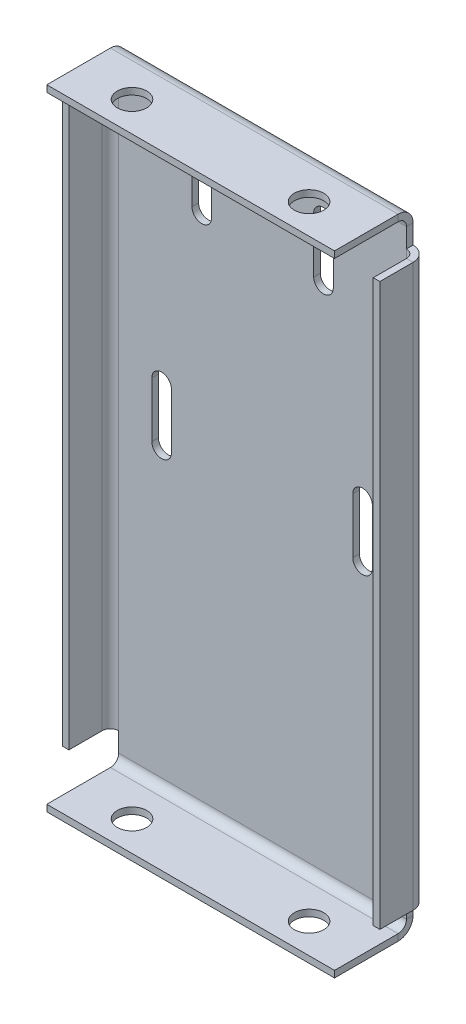
from build123d import *

# Parameters (mm, degrees)
SKETCH1_W           = 66.04
SKETCH1_H           = 147.574
BOSS_EXTRUDE1_DEPTH = 3.03784
SKETCH3_W           = 66.04
SKETCH3_H           = 3.03784
BOSS_EXTRUDE2_DEPTH = 16.51
SKETCH4_R           = 3.3782
CUT_EXTRUDE1_DEPTH  = 163.854183627
SKETCH5_R           = 2.5527
CUT_EXTRUDE2_DEPTH  = 3.03784
BASE_FLANGE1_START  = -66.04
BASE_FLANGE1_DEPTH  = 66.04
SKETCH11_R          = 3.3782
CUT_EXTRUDE3_DEPTH  = 163.854183627
SKETCH12_R          = 2.2479
CUT_EXTRUDE4_DEPTH  = 163.517528827
CUT_EXTRUDE6_DEPTH  = 1.51892
EDGE_FLANGE1_DEPTH  = 128.79832


# Read off the part's stored shape, not the designer's step: Base-Flange1
# Sheet-metal steps are written as plain solids
with BuildPart() as part:
    # Sketch1 → Boss-Extrude1 (new body)
    with BuildSketch(Plane.XY):
        with Locations((33.02, 73.787)):
            Rectangle(SKETCH1_W, SKETCH1_H)
    extrude(amount=BOSS_EXTRUDE1_DEPTH)

    # Sketch3 → Boss-Extrude2 (add)
    with BuildSketch(Plane.XY.offset(3.03784)):
        with Locations((33.02, 146.05508)):
            Rectangle(SKETCH3_W, SKETCH3_H)
        with Locations((33.02, 1.51892)):
            Rectangle(SKETCH3_W, SKETCH3_H)
    extrude(amount=BOSS_EXTRUDE2_DEPTH)

    # Sketch4 → Cut-Extrude1 (cut, through all)
    with BuildSketch(Plane.XZ):
        with Locations(Location((12.7, 12.68984, 0), (0, 0, 270))):
            Circle(SKETCH4_R)
        with Locations(Location((53.34, 12.68984, 0), (0, 0, 270))):
            Circle(SKETCH4_R)
    extrude(amount=-CUT_EXTRUDE1_DEPTH, mode=Mode.SUBTRACT)

    # Sketch5 → Cut-Extrude2 (cut)
    with BuildSketch(Plane.XY.offset(3.03784)):
        with Locations((46.99, 126.449057869)):
            Circle(SKETCH5_R)
        with Locations((19.05, 126.449057869)):
            Circle(SKETCH5_R)
        with Locations((6.35, 75.141057869)):
            Circle(SKETCH5_R)
        with Locations((59.69, 75.141057869)):
            Circle(SKETCH5_R)
    extrude(amount=-CUT_EXTRUDE2_DEPTH, mode=Mode.SUBTRACT)


with BuildPart() as body_2:
    # Base-Flange1 outline → Base-Flange1 (new body)
    with BuildSketch(Plane.ZY.offset(BASE_FLANGE1_START)):
        with BuildLine():
            ThreePointArc((1.51892, 4.94284), (2.52176295, 2.52176295), (4.94284, 1.51892))
            Line((4.94284, 1.51892), (19.54784, 1.51892))
            Line((19.54784, 1.51892), (19.54784, 3.03784))
            Line((19.54784, 3.03784), (4.94284, 3.03784))
            ThreePointArc((4.94284, 3.03784), (3.595801582, 3.595801582), (3.03784, 4.94284))
            Line((3.03784, 4.94284), (3.03784, 142.63116))
            ThreePointArc((3.03784, 142.63116), (3.595801582, 143.978198418), (4.94284, 144.53616))
            Line((4.94284, 144.53616), (19.54784, 144.53616))
            Line((19.54784, 144.53616), (19.54784, 146.05508))
            Line((19.54784, 146.05508), (4.94284, 146.05508))
            ThreePointArc((4.94284, 146.05508), (2.52176295, 145.05223705), (1.51892, 142.63116))
            Line((1.51892, 142.63116), (1.51892, 4.94284))
        make_face()
    extrude(amount=BASE_FLANGE1_DEPTH)

    # Sketch11 → Cut-Extrude3 (cut, through all)
    with BuildSketch(Plane.XZ):
        with Locations((53.34, 12.68984)):
            Circle(SKETCH11_R)
        with Locations((12.7, 12.68984)):
            Circle(SKETCH11_R)
    extrude(amount=-CUT_EXTRUDE3_DEPTH, mode=Mode.SUBTRACT)

    # Sketch12 → Cut-Extrude4 (cut, through all)
    with BuildSketch(Plane.XY.offset(3.03784)):
        with Locations((55.9637, 77.009977807)):
            Circle(SKETCH12_R)
        with Locations((9.8441, 77.009977807)):
            Circle(SKETCH12_R)
        with Locations((46.993900058, 128.317977807)):
            Circle(SKETCH12_R)
        with Locations((19.053900058, 128.317977807)):
            Circle(SKETCH12_R)
    extrude(amount=-CUT_EXTRUDE4_DEPTH, mode=Mode.SUBTRACT)

    # Sketch14 → Cut-Extrude6 (cut)
    with BuildSketch(Plane.XY.offset(3.03784)):
        with BuildLine():
            Line((21.301800058, 134.667977807), (21.301800058, 121.967977807))
            ThreePointArc((21.301800058, 121.967977807), (19.053900058, 119.720077807), (16.806000058, 121.967977807))
            Line((16.806000058, 121.967977807), (16.806000058, 134.667977807))
            ThreePointArc((16.806000058, 134.667977807), (19.053900058, 136.915877807), (21.301800058, 134.667977807))
        make_face()
        with BuildLine():
            Line((53.7158, 70.659977807), (53.7158, 83.359977807))
            ThreePointArc((53.7158, 83.359977807), (55.9637, 85.607877807), (58.2116, 83.359977807))
            Line((58.2116, 83.359977807), (58.2116, 70.659977807))
            ThreePointArc((58.2116, 70.659977807), (55.9637, 68.412077807), (53.7158, 70.659977807))
        make_face()
        with BuildLine():
            Line((49.241800058, 134.667977807), (49.241800058, 121.967977807))
            ThreePointArc((49.241800058, 121.967977807), (46.993900058, 119.720077807), (44.746000058, 121.967977807))
            Line((44.746000058, 121.967977807), (44.746000058, 134.667977807))
            ThreePointArc((44.746000058, 134.667977807), (46.993900058, 136.915877807), (49.241800058, 134.667977807))
        make_face()
        with BuildLine():
            Line((12.092, 83.359977807), (12.092, 70.659977807))
            ThreePointArc((12.092, 70.659977807), (9.8441, 68.412077807), (7.5962, 70.659977807))
            Line((7.5962, 70.659977807), (7.5962, 83.359977807))
            ThreePointArc((7.5962, 83.359977807), (9.8441, 85.607877807), (12.092, 83.359977807))
        make_face()
    extrude(amount=-CUT_EXTRUDE6_DEPTH, mode=Mode.SUBTRACT)

    # Edge-Flange1 section (across the edge) → Edge-Flange1 (add)
    with BuildSketch(Plane(origin=(67.945, 9.38784, 3.03784), x_dir=(-1, 0, 0), z_dir=(0, 1, 0))):
        with BuildLine():
            Line((-1.51892, 1.905), (-1.51892, 9.525))
            Line((-1.51892, 9.525), (0, 9.525))
            Line((0, 9.525), (0, 1.905))
            ThreePointArc((0, 1.905), (0.557961582, 0.557961582), (1.905, 0))
            Line((1.905, 0), (1.905, -1.51892))
            ThreePointArc((1.905, -1.51892), (-0.51607705, -0.51607705), (-1.51892, 1.905))
        make_face()
    edge_flange1 = extrude(amount=EDGE_FLANGE1_DEPTH)

    # Mirror1: Edge-Flange1 across plane
    add(edge_flange1.mirror(Plane(origin=(33.02, 0, 0), x_dir=(0, 0, 1), z_dir=(1, 0, 0))))


solid = body_2.part
